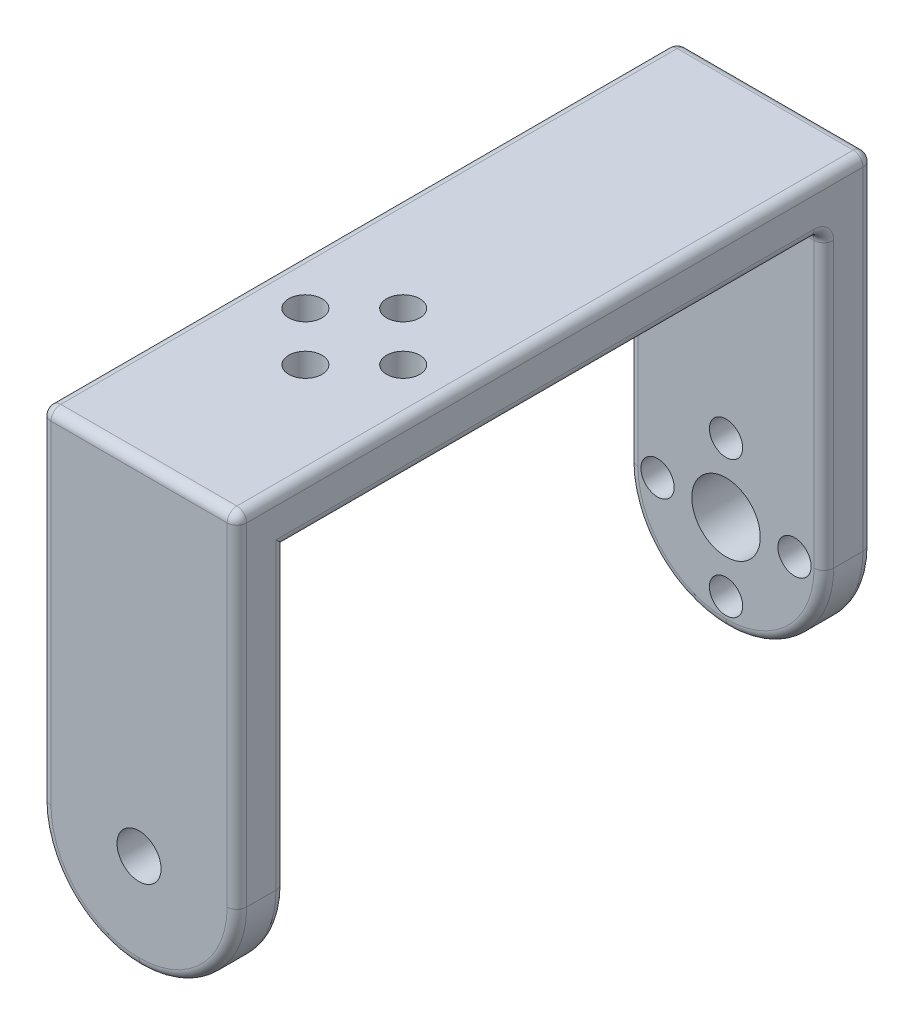
from build123d import *

# Parameters (mm, degrees)
EXTRUDE_1_DEPTH        = 20
FILLET_1_R             = 10
HOLE_WIZARD_M3_1_D     = 3.4
HOLE_WIZARD_M3_1_DEPTH = 20
HOLE_WIZARD_M3_1_TIP   = 1.021463052
HOLE_WIZARD_M4_1_D     = 4.5
HOLE_WIZARD_M4_1_DEPTH = 20
HOLE_WIZARD_M4_1_TIP   = 1.351936393
HOLE_WIZARD_M3_2_D     = 3.4
FILLET_2_R             = 1
SKETCH_8_R             = 3.5
CUT_EXTRUDE_1_DEPTH    = 10


with BuildPart() as part:
    # 草图1 → 凸台-拉伸1 (new body)
    with BuildSketch(Plane(origin=(0, 0, 0), x_dir=(0, 0, -1), z_dir=(1, 0, 0))):
        Polygon((0, 0), (0, 40), (55, 40), (55, 0), (60, 0), (60, 45), (-5, 45), (-5, 0), align=None)
    extrude(amount=EXTRUDE_1_DEPTH)

    # 圆角1
    fillet_1_edges = [part.edges().sort_by_distance(p)[0] for p in [
        (0, 0, -57.5),
        (20, 0, -57.5),
        (0, 0, 2.5),
        (20, 0, 2.5),
    ]]
    fillet(fillet_1_edges, radius=FILLET_1_R - 0.0001)  # a hair under: the kernel refuses the full size

    # M3 间隙孔1
    with Locations(Plane.XY.offset(-55)):
        with Locations((10, 3), (10, 17), (3, 10), (17, 10)):
            Hole(HOLE_WIZARD_M3_1_D / 2, depth=HOLE_WIZARD_M3_1_DEPTH)
            with Locations((0, 0, -(HOLE_WIZARD_M3_1_DEPTH + HOLE_WIZARD_M3_1_TIP / 2))):  # 118° drill point
                Cone(0, HOLE_WIZARD_M3_1_D / 2, HOLE_WIZARD_M3_1_TIP, mode=Mode.SUBTRACT)

    # M4 间隙孔1
    with Locations(Plane(origin=(0, 0, 0), x_dir=(-1, 0, 0), z_dir=(0, 0, -1))):
        with Locations((-10, 10)):
            Hole(HOLE_WIZARD_M4_1_D / 2, depth=HOLE_WIZARD_M4_1_DEPTH)
            with Locations((0, 0, -(HOLE_WIZARD_M4_1_DEPTH + HOLE_WIZARD_M4_1_TIP / 2))):  # 118° drill point
                Cone(0, HOLE_WIZARD_M4_1_D / 2, HOLE_WIZARD_M4_1_TIP, mode=Mode.SUBTRACT)

    # M3 间隙孔2 (through all)
    with Locations(Plane(origin=(0, 45, 0), x_dir=(1, 0, 0), z_dir=(0, 1, 0))):
        with Locations((15, 17), (10, 22), (5, 17), (10, 12)):
            Hole(HOLE_WIZARD_M3_2_D / 2)

    # 圆角2
    fillet_2_edges = [part.edges().sort_by_distance(p)[0] for p in [
        (0, 24.99995, -55),
        (0, 40, -27.5),
        (20, 40, -27.5),
        (10, 45, 5),
        (10, 45, -60),
        (10, 40, -55),
        (20, 24.99995, -55),
        (0, 27.49995, -60),
        (20, 27.49995, -60),
        (17.071097101, 2.928902899, -60),
        (2.928902899, 2.928902899, -60),
        (0, 24.99995, 0),
        (20, 45, -27.5),
        (17.071097101, 2.928902899, -55),
        (2.928902899, 2.928902899, -55),
        (20, 24.99995, 0),
        (20, 27.49995, 5),
        (17.071097101, 2.928902899, 0),
        (2.928902899, 2.928902899, 0),
        (17.071097101, 2.928902899, 5),
        (2.928902899, 2.928902899, 5),
        (0, 27.49995, 5),
        (0, 45, -27.5),
    ]]
    fillet(fillet_2_edges, radius=FILLET_2_R)

    # 草图8 → 切除-拉伸1 (cut)
    with BuildSketch(Plane(origin=(0, 0, -60), x_dir=(-1, 0, 0), z_dir=(0, 0, -1))):
        with Locations((-10, 10)):
            Circle(SKETCH_8_R)
    extrude(amount=-CUT_EXTRUDE_1_DEPTH, mode=Mode.SUBTRACT)


solid = part.part
